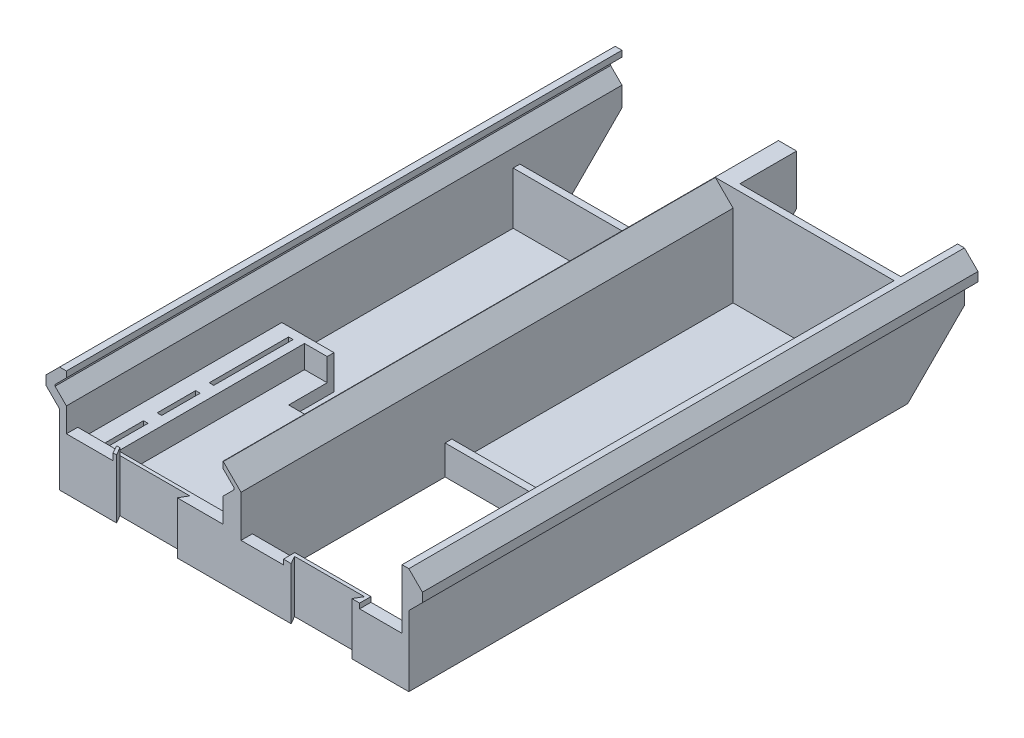
from build123d import *

# Parameters (mm, degrees)
EXTRUDE_1_DEPTH       = 200
SKETCH_2_W            = 148
SKETCH_2_H            = 194
CUT_EXTRUDE_1_DEPTH   = 44
SKETCH_3_W            = 8
SKETCH_3_H            = 194
EXTRUDE_1_2_DEPTH     = 44
CUT_EXTRUDE_2_DEPTH   = 222.580685079
CUT_EXTRUDE_3_DEPTH   = 219.876677606
MOVE_FACE_1_BY        = 2
MOVE_FACE_1_2_BY      = 2
CUT_EXTRUDE_4_DEPTH   = 222.580685079
CUT_EXTRUDE_5_DEPTH   = 16.171573
MOVE_FACE_2_BY        = 45
MOVE_START            = -217
MOVE_FACE_4_DEPTH     = 20
SKETCH_10_W           = 71
SKETCH_10_H           = 47
CUT_EXTRUDE_6_DEPTH   = 25
SKETCH_11_W           = 69
SKETCH_11_H           = 26
CUT_EXTRUDE_7_DEPTH   = 45
CUT_EXTRUDE_8_DEPTH   = 45
CHAMFER_1_SIZE        = 25
CUT_EXTRUDE_9_REACH   = 264.393
SKETCH_13_W           = 71
SKETCH_13_H           = 85
SKETCH_14_W           = 71
SKETCH_14_H           = 3
EXTRUDE_2_DEPTH       = 10
CUT_EXTRUDE_10_DEPTH  = 16.171572875
SKETCH_16_W           = 18.7
SKETCH_16_H           = 5
CUT_EXTRUDE_11_DEPTH  = 4.2
SKETCH_17_W           = 69
SKETCH_17_H           = 90
EXTRUDE_3_DEPTH       = 15
SKETCH_18_W           = 56
SKETCH_18_H           = 87
CUT_EXTRUDE_12_DEPTH  = 10
CUT_EXTRUDE_13_REACH  = 262.298
SKETCH_19_W           = 36
SKETCH_19_H           = 34
SKETCH_21_W           = 2
SKETCH_21_H           = 17
SKETCH_21_H_2         = 35
CUT_EXTRUDE_1_2_DEPTH = 7
MOVE_FACE_5_BY        = 3


# Read off the part's stored shape, not the designer's step: 移动面4
with BuildPart() as part:
    # 草图1 → Extrude 1 (new body)
    with BuildSketch(Plane.XY):
        Polygon((77, 0), (-77, 0), (-77, 31), (-83, 37), (-83, 41), (-77, 47), (77, 47), (83, 41), (83, 37), (77, 31), align=None)
    extrude(amount=-EXTRUDE_1_DEPTH)

    # 草图2 → Cut-Extrude 1 (cut)
    with BuildSketch(Plane(origin=(0, 47, 0), x_dir=(1, 0, 0), z_dir=(0, 1, 0))):
        with Locations((0, 100)):
            Rectangle(SKETCH_2_W, SKETCH_2_H)
    extrude(amount=-CUT_EXTRUDE_1_DEPTH, mode=Mode.SUBTRACT)

    # 草图3 → Extrude 1 2 (add)
    with BuildSketch(Plane(origin=(0, 3, 0), x_dir=(1, 0, 0), z_dir=(0, 1, 0))):
        with Locations((-1, 100)):
            Rectangle(SKETCH_3_W, SKETCH_3_H)
    extrude(amount=EXTRUDE_1_2_DEPTH)

    # 草图6 → 切除-拉伸2 (cut, through all)
    with BuildSketch(Plane.XY):
        Polygon((-74, 47), (-74, 44.343145751), (-79, 39.343145751), (-79, 38.656854249), (-74, 33.656854249), (-74, 26), (-5, 26), (-5, 33.656854249), (0, 38.656854249), (0, 39.343145751), (-5, 44.343145751), (-5, 47), align=None)
    extrude(amount=-CUT_EXTRUDE_2_DEPTH, mode=Mode.SUBTRACT)

    # 草图7 → 切除-拉伸3 (cut, through all)
    with BuildSketch(Plane.XY.offset(-197)):
        Polygon((-4.828427125, 47), (3, 39.171572875), (74, 39.171572875), (74, 47), (3, 47), align=None)
    extrude(amount=CUT_EXTRUDE_3_DEPTH, mode=Mode.SUBTRACT)

    # Move Face 1: a face moved outward by 2.0
    extrude(part.faces().sort_by_distance((-39.5, 14.5, -3))[0], amount=MOVE_FACE_1_BY, dir=(0, 0, -1))

    # Move Face 1 2: a face moved outward by 2.0
    extrude(part.faces().sort_by_distance((38.5, 21.085786438, -3))[0], amount=MOVE_FACE_1_2_BY, dir=(0, 0, -1))

    # 草图8 → 切除-拉伸4 (cut, through all)
    with BuildSketch(Plane.XZ):
        Polygon((-51.883419246, 0), (-53.904145188, -3.5), (-23.095854812, -3.5), (-25.116580754, 0), align=None)
        Polygon((25.116580754, 0), (51.883419246, 0), (53.904145188, -3.5), (23.095854812, -3.5), align=None)
    extrude(amount=-CUT_EXTRUDE_4_DEPTH, mode=Mode.SUBTRACT)

    # 草图9 → 切除-拉伸5 (cut)
    with BuildSketch(Plane(origin=(0, 39.171572875, 0), x_dir=(1, 0, 0), z_dir=(0, 1, 0))):
        Polygon((26.616580754, 0), (24.595854812, 3.5), (55.404145188, 3.5), (53.383419246, 0), (74, 0), (74, 5), (3, 5), (3, 0), align=None)
        Polygon((-55.404145188, 3.5), (-24.595854812, 3.5), (-26.616580754, 0), (-5, 0), (-5, 5), (-74, 5), (-74, 0), (-53.383419246, 0), align=None)
    extrude(amount=-CUT_EXTRUDE_5_DEPTH, mode=Mode.SUBTRACT)

    # Move Face 2: a face moved outward by 45.0
    extrude(part.faces().sort_by_distance((10.164079255, 20.448401084, -200))[0], amount=MOVE_FACE_2_BY, dir=(0, 0, -1))

    # Move Face 4 outline → Move Face 4 (cut)
    with BuildSketch(Plane.XY.offset(MOVE_START)):
        Polygon((74, 3), (74, 47), (-4.828427125, 47), (3, 39.171572875), (3, 3), align=None)
    extrude(amount=MOVE_FACE_4_DEPTH, mode=Mode.SUBTRACT)

    # 草图10 → 切除-拉伸6 (cut)
    with BuildSketch(Plane(origin=(0, 0, -245), x_dir=(-1, 0, 0), z_dir=(0, 0, -1))):
        with Locations((-38.5, 23.5)):
            Rectangle(SKETCH_10_W, SKETCH_10_H)
    extrude(amount=-CUT_EXTRUDE_6_DEPTH, mode=Mode.SUBTRACT)

    # 草图11 → 切除-拉伸7 (cut)
    with BuildSketch(Plane(origin=(0, 0, -245), x_dir=(-1, 0, 0), z_dir=(0, 0, -1))):
        with Locations((39.5, 13)):
            Rectangle(SKETCH_11_W, SKETCH_11_H)
    extrude(amount=-CUT_EXTRUDE_7_DEPTH, mode=Mode.SUBTRACT)

    # 草图12 → 切除-拉伸8 (cut)
    with BuildSketch(Plane(origin=(0, 0, -245), x_dir=(-1, 0, 0), z_dir=(0, 0, -1))):
        Polygon((5, 0), (0, 0), (0, 25.656854249), (5, 30.656854249), align=None)
    extrude(amount=-CUT_EXTRUDE_8_DEPTH, mode=Mode.SUBTRACT)

    # 倒角1
    chamfer_1_edges = [part.edges().sort_by_distance(p)[0] for p in [
        (-75.5, 0, -245),
        (1.5, 0, -245),
        (75.5, 0, -245),
    ]]
    chamfer(chamfer_1_edges, length=CHAMFER_1_SIZE)

    # 草图13 → 切除-拉伸9 (cut, up to next)
    with BuildSketch(Plane(origin=(0, 3, 0), x_dir=(1, 0, 0), z_dir=(0, 1, 0)), mode=Mode.PRIVATE) as cut_extrude_9_sk1:
        with Locations((38.5, 47.5)):
            Rectangle(SKETCH_13_W, SKETCH_13_H)
    cut_extrude_9_tool1 = extrude(cut_extrude_9_sk1.sketch, amount=-CUT_EXTRUDE_9_REACH, mode=Mode.PRIVATE) & part.part
    add(cut_extrude_9_tool1.solids().sort_by_distance((38.5, 3, -47.5))[0], mode=Mode.SUBTRACT)

    # 草图14 → 凸台-拉伸2 (add)
    with BuildSketch(Plane(origin=(0, 3, 0), x_dir=(1, 0, 0), z_dir=(0, 1, 0))):
        with Locations((38.5, 91.5)):
            Rectangle(SKETCH_14_W, SKETCH_14_H)
    extrude(amount=EXTRUDE_2_DEPTH)

    # 草图15 → 切除-拉伸10 (cut)
    with BuildSketch(Plane(origin=(0, 39.171572875, 0), x_dir=(1, 0, 0), z_dir=(0, 1, 0))):
        Polygon((51.883419246, 0), (53.904145188, 3.5), (55.404145188, 3.5), (53.383419246, 0), align=None)
    extrude(amount=-CUT_EXTRUDE_10_DEPTH, mode=Mode.SUBTRACT)

    # 草图16 → 切除-拉伸11 (cut)
    with BuildSketch(Plane(origin=(0, 25, 0), x_dir=(1, 0, 0), z_dir=(0, 1, 0))):
        with Locations((12.35, 2.5)):
            Rectangle(SKETCH_16_W, SKETCH_16_H)
        with Locations((64.65, 2.5)):
            Rectangle(SKETCH_16_W, SKETCH_16_H)
    extrude(amount=-CUT_EXTRUDE_11_DEPTH, mode=Mode.SUBTRACT)

    # 草图17 → 凸台-拉伸3 (add)
    with BuildSketch(Plane(origin=(0, 3, 0), x_dir=(1, 0, 0), z_dir=(0, 1, 0))):
        with Locations((-39.5, 50)):
            Rectangle(SKETCH_17_W, SKETCH_17_H)
    extrude(amount=EXTRUDE_3_DEPTH)

    # 草图18 → 切除-拉伸12 (cut)
    with BuildSketch(Plane(origin=(0, 18, 0), x_dir=(1, 0, 0), z_dir=(0, 1, 0))):
        with Locations((-33, 48.5)):
            Rectangle(SKETCH_18_W, SKETCH_18_H)
    extrude(amount=-CUT_EXTRUDE_12_DEPTH, mode=Mode.SUBTRACT)

    # 切除-拉伸13: up to this face of the body (flat: up to its plane)
    cut_extrude_13_end = Plane(part.part.faces().sort_by_distance((-39.5, 3, -146))[0])
    # 草图19 → 切除-拉伸13 (cut, up to the picked face)
    with BuildSketch(Plane(origin=(0, 18, 0), x_dir=(1, 0, 0), z_dir=(0, 1, 0)), mode=Mode.PRIVATE) as cut_extrude_13_sk1:
        with Locations((-33, 92)):
            Rectangle(SKETCH_19_W, SKETCH_19_H)
    cut_extrude_13_tool1 = split(extrude(cut_extrude_13_sk1.sketch, amount=-CUT_EXTRUDE_13_REACH, mode=Mode.PRIVATE), bisect_by=cut_extrude_13_end, keep=Keep.BOTH, mode=Mode.PRIVATE)
    add(cut_extrude_13_tool1.solids().sort_by(Axis((-33, 18, -92), (0, -1, 0)))[0], mode=Mode.SUBTRACT)

    # 草图21 → Cut-Extrude 1 2 (cut)
    with BuildSketch(Plane(origin=(0, 18, 0), x_dir=(1, 0, 0), z_dir=(0, 1, 0))):
        with Locations((-66, 18.5)):
            Rectangle(SKETCH_21_W, SKETCH_21_H)
        with Locations((-66, 41.5)):
            Rectangle(SKETCH_21_W, SKETCH_21_H)
        with Locations((-66, 73.5)):
            Rectangle(SKETCH_21_W, SKETCH_21_H_2)
    extrude(amount=-CUT_EXTRUDE_1_2_DEPTH, mode=Mode.SUBTRACT)

    # Move Face 5: a face moved outward by 3.0
    extrude(part.faces().sort_by_distance((-66, 11, -73.5))[0], amount=MOVE_FACE_5_BY, dir=(0, 1, 0))


solid = part.part
